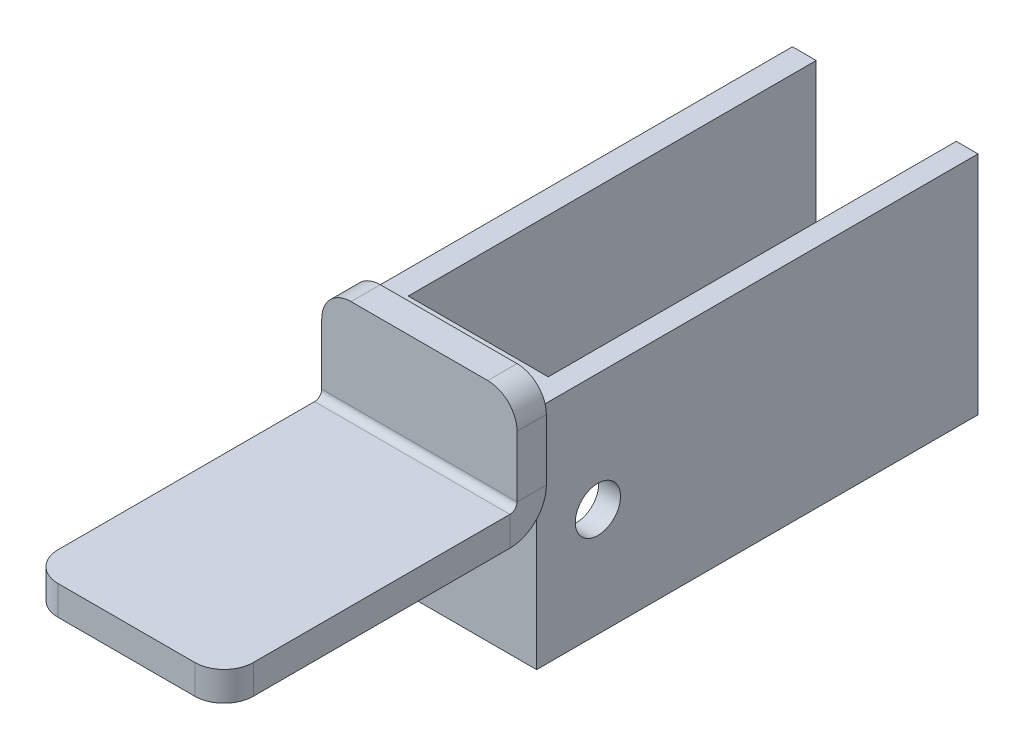
from build123d import *

# Parameters (mm, degrees)
BASE_FLANGE1_DEPTH  = 20
FILLET1_R           = 3
SKETCH2_W           = 45.198925831
SKETCH2_H           = 23.140478888
BOSS_EXTRUDE1_DEPTH = 19
SKETCH3_W           = 14.337687556
SKETCH3_H           = 41.775325978
CUT_EXTRUDE1_DEPTH  = 26
SKETCH4_R           = 2.315491067
CUT_EXTRUDE2_DEPTH  = 26


# Sheet-metal steps are written as plain solids
with BuildPart() as part:
    # Sketch1 → Base-Flange1 (new body)
    with BuildSketch(Plane(origin=(0, 0, 0), x_dir=(0, 0, -1), z_dir=(1, 0, 0))):
        with BuildLine():
            Line((0, 0), (29.2634, 0))
            ThreePointArc((29.2634, 0), (29.784254855, 0.215745145), (30, 0.7366))
            Line((30, 0.7366), (30, 10))
            Line((30, 10), (33, 10))
            Line((33, 10), (33, 0.7366))
            ThreePointArc((33, 0.7366), (31.905575199, -1.905575199), (29.2634, -3))
            Line((29.2634, -3), (0, -3))
            Line((0, -3), (0, 0))
        make_face()
    extrude(amount=BASE_FLANGE1_DEPTH)

    # Fillet1
    fillet1_edges = [part.edges().sort_by_distance(p)[0] for p in [
        (20, -1.5, 0),
        (20, 10, -31.5),
        (0, -1.5, 0),
        (0, 10, -31.5),
    ]]
    fillet(fillet1_edges, radius=FILLET1_R)

    # Sketch2 → Boss-Extrude1 (add)
    with BuildSketch(Plane.ZY):
        with Locations((-55.599462916, -4.570239444)):
            Rectangle(SKETCH2_W, SKETCH2_H)
    extrude(amount=-BOSS_EXTRUDE1_DEPTH)

    # Sketch3 → Cut-Extrude1 (cut)
    with BuildSketch(Plane(origin=(0, -16.140478888, 0), x_dir=(-1, 0, 0), z_dir=(0, -1, 0))):
        with Locations((-9.603922135, 57.311262842)):
            Rectangle(SKETCH3_W, SKETCH3_H)
    extrude(amount=-CUT_EXTRUDE1_DEPTH, mode=Mode.SUBTRACT)

    # Sketch4 → Cut-Extrude2 (cut)
    with BuildSketch(Plane.ZY):
        with Locations((-39.276024705, -5.060706685)):
            Circle(SKETCH4_R)
    extrude(amount=-CUT_EXTRUDE2_DEPTH, mode=Mode.SUBTRACT)


solid = part.part
